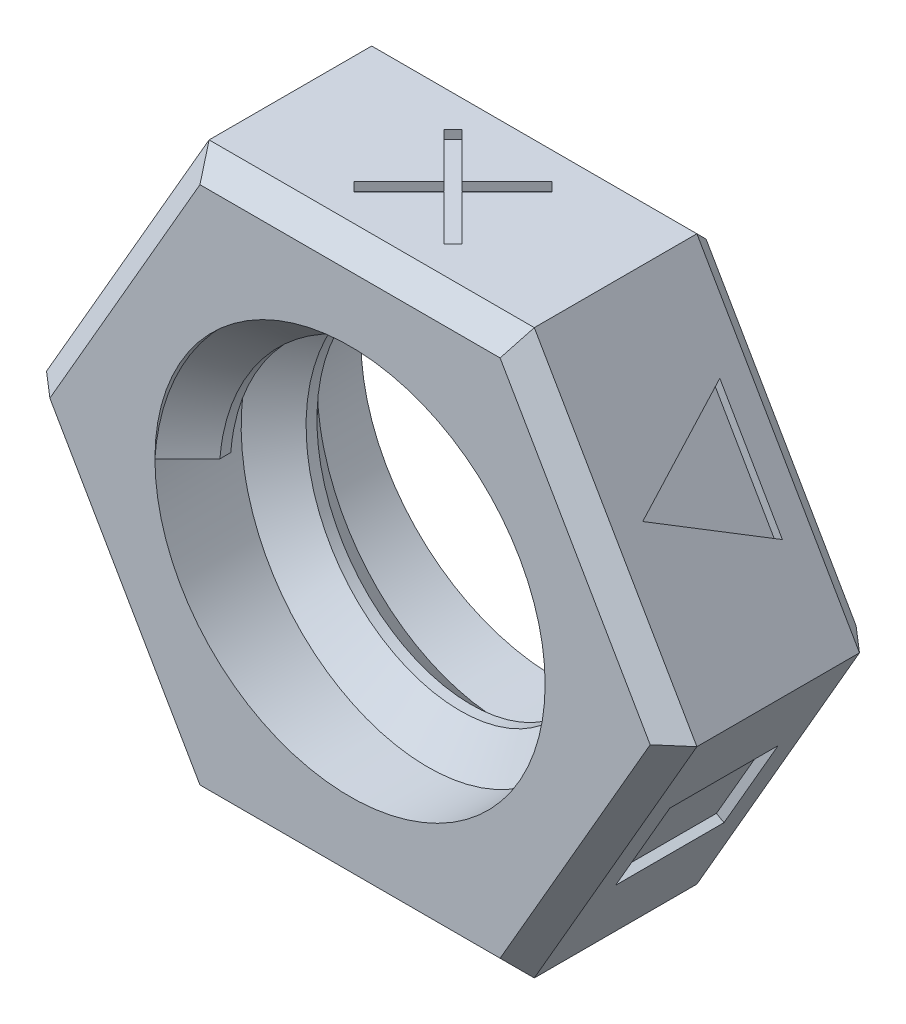
from build123d import *

# Parameters (mm, degrees)
EXTRUDE_1_DEPTH          = 9.5
SKETCH_3_R               = 9
CUT_EXTRUDE_1_DEPTH      = 10
SWEEP_1_PITCH            = 4
CHAMFER_1_SIZE           = 1
CUT_EXTRUDE_3_DEPTH      = 0.4
SKETCH_12_R              = 2.5
CUT_EXTRUDE_4_DEPTH      = 0.4
CUT_EXTRUDE_6_DEPTH      = 32.468328554
CUT_EXTRUDE_6_DEPTH_BACK = 0.4
SKETCH_11_W              = 5
SKETCH_11_H              = 5
CUT_EXTRUDE_7_DEPTH      = 0.4


with BuildPart() as part:
    # 草图1 → 凸台-拉伸1 (new body)
    with BuildSketch(Plane.XY):
        Polygon((15, 0), (7.5, 12.990381057), (-7.5, 12.990381057), (-15, 0), (-7.5, -12.990381057), (7.5, -12.990381057), align=None)
    extrude(amount=EXTRUDE_1_DEPTH)

    # 草图3 → 切除-拉伸1 (cut)
    with BuildSketch(Plane(origin=(0, 0, 0), x_dir=(-1, 0, 0), z_dir=(0, 0, -1))):
        Circle(SKETCH_3_R)
    extrude(amount=-CUT_EXTRUDE_1_DEPTH, mode=Mode.SUBTRACT)

    # 扫描1: the profile of 草图5 profile screwed along a right-hand helix of 1.5 turns, 12 arcs to a turn; built about Z, then put on its axis
    sweep_1_z = Axis((0, 0, 0), (0, 0, 1))
    sweep_1_corners = [(9.0003, 0, -1.7503), (9.0003, 0, 1.7503), (7.5, 0, 0.25), (7.5, 0, -0.25)]
    with BuildLine(mode=Mode.PRIVATE) as sweep_1_profile:
        Line(sweep_1_corners[0], sweep_1_corners[1])
        Line(sweep_1_corners[1], sweep_1_corners[2])
        Line(sweep_1_corners[2], sweep_1_corners[3])
        Line(sweep_1_corners[3], sweep_1_corners[0])
    sweep_1_cap = Face(sweep_1_profile.wire())
    sweep_1_turn_angles = [0, 15, 30, 45, 60, 75, 90, 105, 120, 135, 150, 165, 180, 195, 210, 225, 240, 255, 270, 285, 300, 315, 330, 345, 360]
    sweep_1_turn_weights = [1, 0.9659258262890683, 1, 0.9659258262890683, 1, 0.9659258262890683, 1, 0.9659258262890683, 1, 0.9659258262890683, 1, 0.9659258262890683, 1, 0.9659258262890683, 1, 0.9659258262890683, 1, 0.9659258262890683, 1, 0.9659258262890683, 1, 0.9659258262890683, 1, 0.9659258262890683, 1]
    sweep_1_turn_rails = [Edge.make_bspline([Vector(p[0], p[1], 0).rotate(sweep_1_z, sweep_1_turn_angles[k]) / sweep_1_turn_weights[k] + Vector(0, 0, p[2] + SWEEP_1_PITCH * sweep_1_turn_angles[k] / 360) for k in range(25)], [0, 0, 0, 1, 1, 2, 2, 3, 3, 4, 4, 5, 5, 6, 6, 7, 7, 8, 8, 9, 9, 10, 10, 11, 11, 12, 12, 12], 2, sweep_1_turn_weights) for p in sweep_1_corners]
    sweep_1_turn_sides = [Face.make_surface_from_curves(sweep_1_turn_rails[p[0]], sweep_1_turn_rails[p[1]]) for p in [(0, 1), (1, 2), (2, 3), (3, 0)]]
    sweep_1_last_angles = [360, 375, 390, 405, 420, 435, 450, 465, 480, 495, 510, 525, 540]
    sweep_1_last_weights = [1, 0.9659258262890683, 1, 0.9659258262890683, 1, 0.9659258262890683, 1, 0.9659258262890683, 1, 0.9659258262890683, 1, 0.9659258262890658, 1]
    sweep_1_last_rails = [Edge.make_bspline([Vector(p[0], p[1], 0).rotate(sweep_1_z, sweep_1_last_angles[k]) / sweep_1_last_weights[k] + Vector(0, 0, p[2] + SWEEP_1_PITCH * sweep_1_last_angles[k] / 360) for k in range(13)], [0, 0, 0, 1, 1, 2, 2, 3, 3, 4, 4, 5, 5, 6, 6, 6], 2, sweep_1_last_weights) for p in sweep_1_corners]
    sweep_1_last_sides = [Face.make_surface_from_curves(sweep_1_last_rails[p[0]], sweep_1_last_rails[p[1]]) for p in [(0, 1), (1, 2), (2, 3), (3, 0)]]
    sweep_1 = Plane(origin=(0, 0, 1.75), x_dir=(1, 0, 0), z_dir=(0, 0, 1)) * Solid(Shell([*sweep_1_turn_sides, *sweep_1_last_sides, sweep_1_cap, sweep_1_cap.rotate(sweep_1_z, 540).moved(Location((0, 0, SWEEP_1_PITCH * 540 / 360)))]))
    add(sweep_1)

    # 倒角1
    chamfer_1_edges = [part.edges().sort_by_distance(p)[0] for p in [
        (-11.25, 6.495190528, 9.5),
        (-11.25, -6.495190528, 9.5),
        (0, -12.990381057, 9.5),
        (11.25, -6.495190528, 9.5),
        (11.25, 6.495190528, 9.5),
        (11.25, -6.495190528, 0),
        (0, -12.990381057, 0),
        (-11.25, -6.495190528, 0),
        (-11.25, 6.495190528, 0),
        (0, 12.990381057, 0),
        (11.25, 6.495190528, 0),
        (0, 12.990381057, 9.5),
    ]]
    chamfer(chamfer_1_edges, length=CHAMFER_1_SIZE)

    # 草图7 → 切除-拉伸3 (cut)
    with BuildSketch(Plane(origin=(11.25, 6.495190528, 0), x_dir=(0, 0, -1), z_dir=(0.8660254037844386, 0.5000000000000003, 0))):
        Polygon((-2.25, 2.886751346), (-7.25, 0), (-2.25, -2.886751346), align=None)
    extrude(amount=-CUT_EXTRUDE_3_DEPTH, mode=Mode.SUBTRACT)

    # 草图12 → 切除-拉伸4 (cut)
    with BuildSketch(Plane(origin=(-11.25, 6.495190528, 0), x_dir=(0, 0, 1), z_dir=(-0.8660254037844384, 0.5000000000000006, 0))):
        with Locations(Location((4.75, 0, 0), (0, 0, 270))):
            Circle(SKETCH_12_R)
    extrude(amount=-CUT_EXTRUDE_4_DEPTH, mode=Mode.SUBTRACT)

    # 草图10 → 切除-拉伸6 (cut, two sides: drawn at the far end of the back side and taken through both)
    with BuildSketch(Plane(origin=(0, 12.990381057, 0), x_dir=(1, 0, 0), z_dir=(0, 1, 0)).offset(-CUT_EXTRUDE_6_DEPTH_BACK)):
        Polygon((2.075735931, -2.25), (-2.5, -6.825735931), (-2.075735931, -7.25), (2.5, -2.674264069), align=None)
        Polygon((-2.5, -2.674264069), (2.075735931, -7.25), (2.5, -6.825735931), (-2.075735931, -2.25), align=None)
    extrude(amount=CUT_EXTRUDE_6_DEPTH + CUT_EXTRUDE_6_DEPTH_BACK, mode=Mode.SUBTRACT)

    # 草图11 → 切除-拉伸7 (cut)
    with BuildSketch(Plane(origin=(11.25, -6.495190528, 0), x_dir=(0, 0, -1), z_dir=(0.8660254037844387, -0.5000000000000001, 0))):
        with Locations((-4.75, 0)):
            Rectangle(SKETCH_11_W, SKETCH_11_H)
    extrude(amount=-CUT_EXTRUDE_7_DEPTH, mode=Mode.SUBTRACT)


solid = part.part
